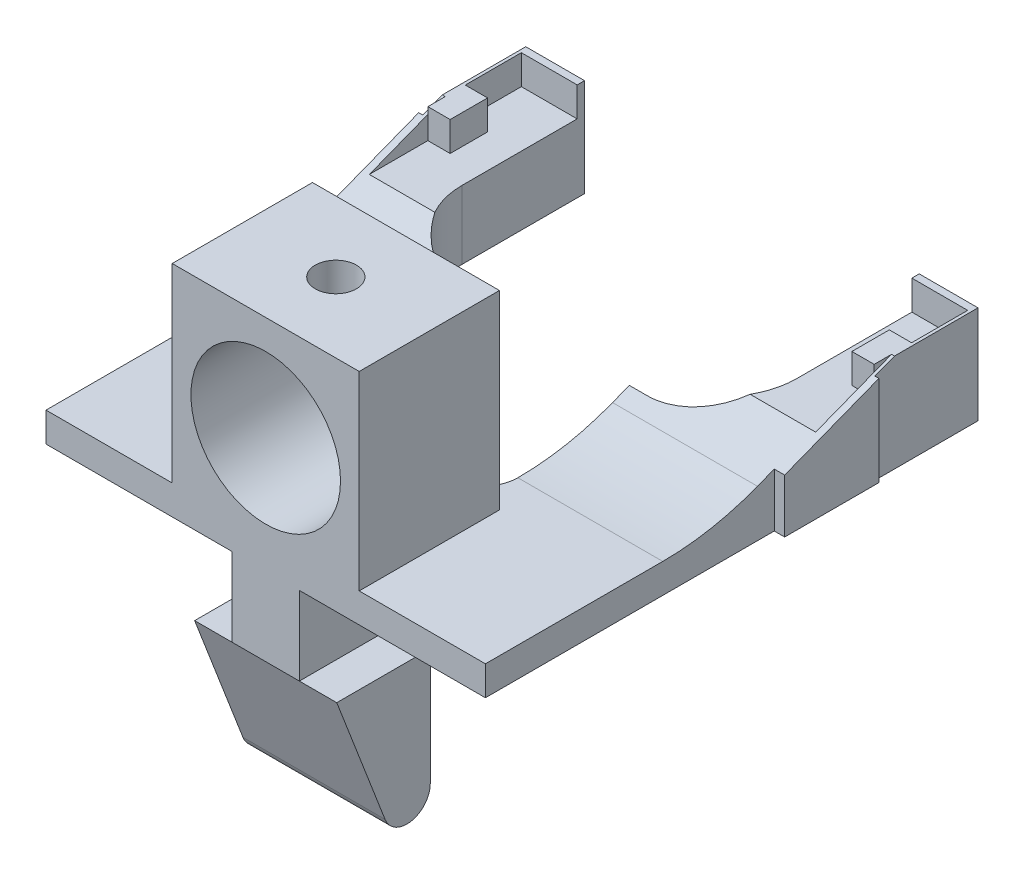
from build123d import *

# Parameters (mm, degrees)
SKETCH2_W                = 12.7
SKETCH2_H                = 14.91
SKETCH2_R                = 5.08
BOSS_EXTRUDE1_DEPTH      = 9.525
BOSS_EXTRUDE2_START      = 9.525
BOSS_EXTRUDE2_DEPTH      = 6.35
BOSS_EXTRUDE3_DEPTH      = 2
BOSS_EXTRUDE7_START      = -25.4
BOSS_EXTRUDE7_DEPTH      = 50.8
SKETCH5_W                = 9.77111141
SKETCH5_H                = 3
CUT_EXTRUDE1_DEPTH       = 68.279429146
CUT_EXTRUDE2_START       = -12.902497
SKETCH6_W                = 30.31497918
SKETCH6_H                = 2.000002
SKETCH6_W_2              = 22.73097918
SKETCH6_H_2              = 6.646875
CUT_EXTRUDE2_DEPTH       = 12.902497
CUT_EXTRUDE3_START       = 0.499999
SKETCH6_3_W              = 22.73097918
SKETCH6_3_H              = 2.000002
SKETCH6_3_H_2            = 4.646873
SKETCH6_3_W_2            = 0.271399
SKETCH6_3_H_3            = 3
CUT_EXTRUDE3_DEPTH       = 7.0000114
FILLET2_R                = 17.78
CUT_EXTRUDE4_DEPTH       = 33.871006443
CUT_EXTRUDE4_DEPTH_BACK  = 33.871006443
SKETCH7_W                = 10.16
SKETCH7_H                = 10.092503778
FILLET3_R                = 2.54
SKETCH8_W                = 1.515
SKETCH8_H                = 2.54
BOSS_EXTRUDE8_DEPTH      = 2
FILLET4_R                = 5.08
CUT_EXTRUDE5_DEPTH       = 35.535859512
BOSS_EXTRUDE9_DEPTH      = 3.646875
SET_SCREW_CUT_REACH      = 43.018
SET_SCREW_CUT_END_RADIUS = 5.08
SKETCH12_R               = 1.4


# Read off the part's stored shape, not the designer's step: Boss-Extrude7
with BuildPart() as part:
    # Sketch2 → Boss-Extrude1 (new body)
    with BuildSketch(Plane.XY):
        with Locations((0, 7.455)):
            Rectangle(SKETCH2_W, SKETCH2_H)
        with Locations(Location((0, 7.83, 0), (0, 0, 180))):
            Circle(SKETCH2_R, mode=Mode.SUBTRACT)
    extrude(amount=BOSS_EXTRUDE1_DEPTH)

    # Sketch2<3> → Boss-Extrude2 (add)
    with BuildSketch(Plane.XY.offset(BOSS_EXTRUDE2_START)):
        Polygon((2.286, 0), (-2.286, 0), (-2.286, -5.334), (-4.826, -5.334), (-4.826, -14.859), (4.826, -14.859), (4.826, -5.334), (2.286, -5.334), align=None)
    extrude(amount=-BOSS_EXTRUDE2_DEPTH)

    # Sketch3 → Boss-Extrude3 (add)
    with BuildSketch(Plane.XZ):
        Polygon((14.9225, 9.525), (-14.9225, 9.525), (-14.9225, -11.557), (-10.85748959, -11.557), (10.85748959, -11.557), (14.9225, -11.557), align=None)
    extrude(amount=-BOSS_EXTRUDE3_DEPTH)

    # Boss-Extrude7 outline → Boss-Extrude7 (add)
    with BuildSketch(Plane(origin=(0, 0, 0), x_dir=(0, 0, -1), z_dir=(1, 0, 0)).offset(BOSS_EXTRUDE7_START)):
        with BuildLine():
            Line((5.848505491, 2), (11.557, 0))
            Line((11.557, 0), (12.724273166, 0.598024588))
            ThreePointArc((12.724273166, 0.598024588), (12.796184179, 0.55223881), (12.869936616, 0.509482413))
            Line((12.869936616, 0.509482413), (20.955, 3.646875))
            Line((20.955, 3.646875), (23.495, 3.646875))
            Line((23.495, 3.646875), (23.495, 6.646875))
            Line((23.495, 6.646875), (17.823506348, 6.646875))
            Line((17.823506348, 6.646875), (5.848505491, 2))
        make_face()
    extrude(amount=BOSS_EXTRUDE7_DEPTH)

    # Sketch5 → Cut-Extrude1 (cut, through all)
    with BuildSketch(Plane(origin=(0, 37.971305566, -23.495), x_dir=(1, 0, 0), z_dir=(0, 0, 1))):
        Polygon((25.4, -37.971305566), (25.4, -34.324430566), (15.62888859, -34.324430566), (14.9225, -34.324430566), (14.9225, -37.971305566), align=None)
        with Locations((20.514444295, -32.824430566)):
            Rectangle(SKETCH5_W, SKETCH5_H)
        Polygon((-25.4, -34.324430566), (-25.4, -37.971305566), (-14.9225, -37.971305566), (-14.9225, -34.324430566), (-15.62888859, -34.324430566), align=None)
        with Locations((-20.514444295, -32.824430566)):
            Rectangle(SKETCH5_W, SKETCH5_H)
    extrude(amount=CUT_EXTRUDE1_DEPTH, mode=Mode.SUBTRACT)

    # Sketch6 → Cut-Extrude2 (cut)
    with BuildSketch(Plane(origin=(0, 0, -22.995001), x_dir=(-1, 0, 0), z_dir=(0, 0, -1)).offset(CUT_EXTRUDE2_START)):
        with Locations((0, 5.646874)):
            Rectangle(SKETCH6_W, SKETCH6_H)
        with Locations((0, 3.3234375)):
            Rectangle(SKETCH6_W_2, SKETCH6_H_2)
    extrude(amount=CUT_EXTRUDE2_DEPTH, mode=Mode.SUBTRACT)

    # Sketch6<3> → Cut-Extrude3 (cut)
    with BuildSketch(Plane(origin=(0, 0, -22.995001), x_dir=(-1, 0, 0), z_dir=(0, 0, -1)).offset(CUT_EXTRUDE3_START)):
        with Locations((0, 5.646874)):
            Rectangle(SKETCH6_3_W, SKETCH6_3_H)
        with Locations((0, 2.3234365)):
            Rectangle(SKETCH6_3_W, SKETCH6_3_H_2)
        with Locations((-15.49318909, 5.146875)):
            Rectangle(SKETCH6_3_W_2, SKETCH6_3_H_3)
        with Locations((15.49318909, 5.146875)):
            Rectangle(SKETCH6_3_W_2, SKETCH6_3_H_3)
    extrude(amount=-CUT_EXTRUDE3_DEPTH, mode=Mode.SUBTRACT)

    # Fillet2
    fillet2_edges = [part.edges().sort_by_distance(p)[0] for p in [
        (0, 2, -5.848505491),
    ]]
    fillet(fillet2_edges, radius=FILLET2_R)

    # Sketch7 → Cut-Extrude4 (cut, two sides: drawn at the far end of the back side and taken through both)
    with BuildSketch(Plane(origin=(0, 2, 0), x_dir=(1, 0, 0), z_dir=(0, 1, 0)).offset(-CUT_EXTRUDE4_DEPTH_BACK)):
        with Locations((0, 5.046251889)):
            Rectangle(SKETCH7_W, SKETCH7_H)
    extrude(amount=CUT_EXTRUDE4_DEPTH + CUT_EXTRUDE4_DEPTH_BACK, mode=Mode.SUBTRACT)

    # Fillet3
    # the kernel refuses this fillet: 2.54 mm, written as the material it adds along each edge
    with BuildSketch(Plane(origin=(-5.08, 2, 0), x_dir=(1, 0, 0), z_dir=(0, -1, 0))) as fillet3_piece_1:
        with BuildLine():
            CenterArc((FILLET3_R, -FILLET3_R), FILLET3_R, 90, 90)
            Line((0, -FILLET3_R), (-FILLET3_R * 0.02, -FILLET3_R))
            Line((-FILLET3_R * 0.02, -FILLET3_R), (-FILLET3_R * 0.02, FILLET3_R * 0.02))
            Line((-FILLET3_R * 0.02, FILLET3_R * 0.02), (FILLET3_R, FILLET3_R * 0.02))
            Line((FILLET3_R, FILLET3_R * 0.02), (FILLET3_R, 0))
        make_face()
    extrude(amount=2)
    with BuildSketch(Plane(origin=(5.08, 0, 0), x_dir=(0, 0, -1), z_dir=(0, 1, 0))) as fillet3_piece_2:
        with BuildLine():
            CenterArc((FILLET3_R, FILLET3_R), FILLET3_R, 180, 90)
            Line((0, FILLET3_R), (-FILLET3_R * 0.02, FILLET3_R))
            Line((-FILLET3_R * 0.02, FILLET3_R), (-FILLET3_R * 0.02, -FILLET3_R * 0.02))
            Line((-FILLET3_R * 0.02, -FILLET3_R * 0.02), (FILLET3_R, -FILLET3_R * 0.02))
            Line((FILLET3_R, -FILLET3_R * 0.02), (FILLET3_R, 0))
        make_face()
    extrude(amount=2)

    # Sketch8 → Boss-Extrude8 (add)
    with BuildSketch(Plane(origin=(0, 4.646873, 0), x_dir=(1, 0, 0), z_dir=(0, 1, 0))):
        with Locations((-14.39998959, 17.915001)):
            Rectangle(SKETCH8_W, SKETCH8_H)
        with Locations((14.39998959, 17.915001)):
            Rectangle(SKETCH8_W, SKETCH8_H)
    extrude(amount=BOSS_EXTRUDE8_DEPTH)

    # Fillet4
    fillet4_edges = [part.edges().sort_by_distance(p)[0] for p in [
        (11.36548959, 1.823437543, -10.092504),
        (-11.36548959, 1.823437543, -10.092504),
    ]]
    fillet(fillet4_edges, radius=FILLET4_R)

    # Sketch10 → Cut-Extrude5 (cut, through all)
    with BuildSketch(Plane(origin=(4.826, 0, 0), x_dir=(0, 0, -1), z_dir=(1, 0, 0))):
        with BuildLine():
            Line((-6.243675471, -13.842705282), (-9.525, -5.334))
            Line((-9.525, -5.334), (-9.525, -14.859))
            Line((-9.525, -14.859), (-4.7625, -14.859))
            ThreePointArc((-4.7625, -14.859), (-5.660655851, -14.580496684), (-6.243675471, -13.842705282))
        make_face()
        with BuildLine():
            ThreePointArc((-3.175, -13.2715), (-3.639967985, -14.394032015), (-4.7625, -14.859))
            Line((-4.7625, -14.859), (-3.175, -14.859))
            Line((-3.175, -14.859), (-3.175, -13.2715))
        make_face()
    extrude(amount=-CUT_EXTRUDE5_DEPTH, mode=Mode.SUBTRACT)

    # Sketch11 → Boss-Extrude9 (add)
    with BuildSketch(Plane.XZ.offset(-3.646875)):
        with BuildLine():
            Line((11.36548959, -20.955), (11.36548959, -15.172503778))
            ThreePointArc((11.36548959, -15.172503778), (11.225613574, -13.98862244), (10.8136884, -12.869936616))
            Line((10.8136884, -12.869936616), (10.8136884, -10.092503778))
            Line((10.8136884, -10.092503778), (14.9225, -10.092503778))
            Line((14.9225, -10.092503778), (15.62888859, -10.092503778))
            Line((15.62888859, -10.092503778), (15.62888859, -16.4949886))
            Line((15.62888859, -16.4949886), (15.35748959, -16.4949886))
            Line((15.35748959, -16.4949886), (15.35748959, -23.495))
            Line((15.35748959, -23.495), (11.36548959, -23.495))
            Line((11.36548959, -23.495), (11.36548959, -20.955))
        make_face()
        with BuildLine():
            Line((-14.9225, -10.092503778), (-10.8136884, -10.092503778))
            Line((-10.8136884, -10.092503778), (-10.8136884, -12.869936616))
            ThreePointArc((-10.8136884, -12.869936616), (-11.225613574, -13.98862244), (-11.36548959, -15.172503778))
            Line((-11.36548959, -15.172503778), (-11.36548959, -20.955))
            Line((-11.36548959, -20.955), (-11.36548959, -23.495))
            Line((-11.36548959, -23.495), (-15.35748959, -23.495))
            Line((-15.35748959, -23.495), (-15.35748959, -16.4949886))
            Line((-15.35748959, -16.4949886), (-15.62888859, -16.4949886))
            Line((-15.62888859, -16.4949886), (-15.62888859, -10.092503778))
            Line((-15.62888859, -10.092503778), (-14.9225, -10.092503778))
        make_face()
    extrude(amount=BOSS_EXTRUDE9_DEPTH)

    # Set Screw Cut: up to this cylinder (the profile starts outside it)
    set_screw_cut_end = Plane(origin=(0, 7.83, 4.7625), z_dir=(0, 0, -1)) * Cylinder(SET_SCREW_CUT_END_RADIUS, 97.196, mode=Mode.PRIVATE)
    # Sketch12 → Set Screw Cut (cut, up to the surface)
    with BuildSketch(Plane(origin=(0, 14.91, 0), x_dir=(1, 0, 0), z_dir=(0, 1, 0)), mode=Mode.PRIVATE) as set_screw_cut_sk1:
        with Locations(Location((0, -4.7625, 0), (0, 0, 180))):
            Circle(SKETCH12_R)
    set_screw_cut_tool1 = extrude(set_screw_cut_sk1.sketch, amount=-SET_SCREW_CUT_REACH, mode=Mode.PRIVATE) - set_screw_cut_end
    add(set_screw_cut_tool1.solids().sort_by_distance((0, 14.91, 4.7625))[0], mode=Mode.SUBTRACT)


solid = part.part
